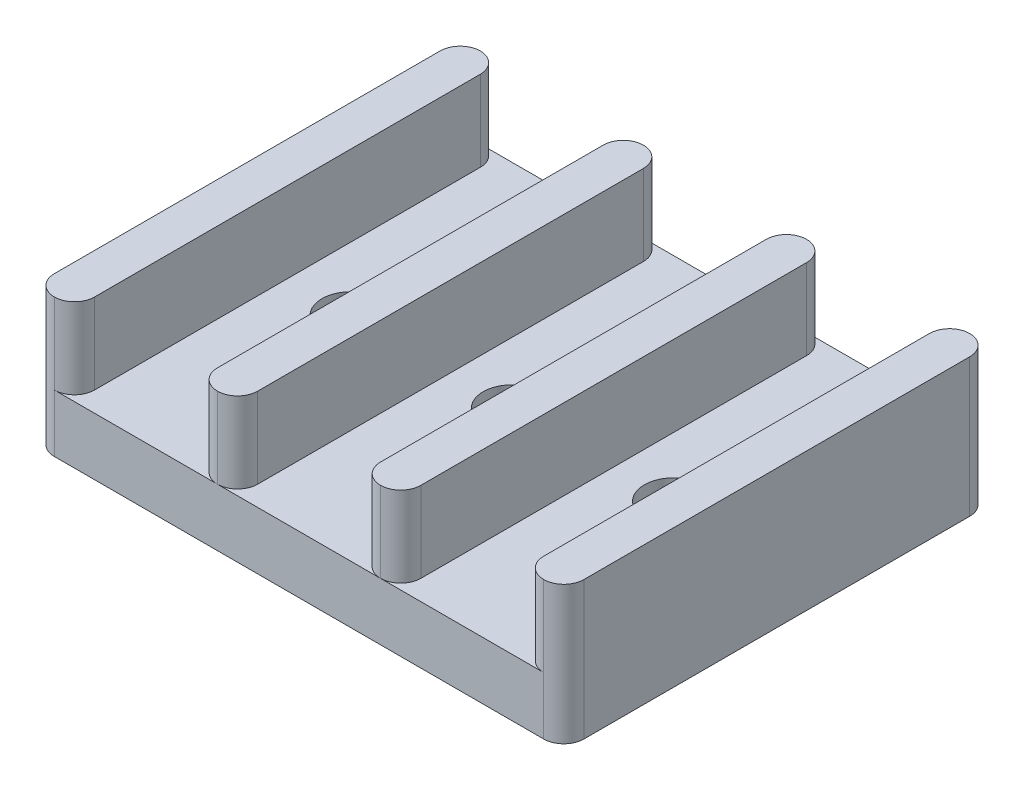
from build123d import *

# Parameters (mm, degrees)
SKETCH1_W           = 46
SKETCH1_H           = 37
SKETCH1_R           = 2.5
BOSS_EXTRUDE1_DEPTH = 12
CUT_EXTRUDE1_START  = -7
SKETCH2_W           = 10.6666
SKETCH2_H           = 37
SKETCH2_R           = 2.5
CUT_EXTRUDE1_DEPTH  = 7
FILLET1_R           = 1.75


with BuildPart() as part:
    # Sketch1 → Boss-Extrude1 (new body)
    with BuildSketch(Plane(origin=(0, 0, 0), x_dir=(1, 0, 0), z_dir=(0, 1, 0))):
        with Locations((-1.399026764, 3.604622871)):
            Rectangle(SKETCH1_W, SKETCH1_H)
        with Locations(Location((-1.399026764, 3.604622871, 0), (0, 0, 270))):
            Circle(SKETCH1_R, mode=Mode.SUBTRACT)
        with Locations(Location((-15.399026764, 3.604622871, 0), (0, 0, 270))):
            Circle(SKETCH1_R, mode=Mode.SUBTRACT)
        with Locations(Location((12.600973236, 3.604622871, 0), (0, 0, 270))):
            Circle(SKETCH1_R, mode=Mode.SUBTRACT)
    extrude(amount=BOSS_EXTRUDE1_DEPTH)

    # Sketch2 → Cut-Extrude1 (cut)
    # profile 1 of 3: a face of its own
    with BuildSketch(Plane(origin=(0, 12, 0), x_dir=(1, 0, 0), z_dir=(0, 1, 0)).offset(CUT_EXTRUDE1_START)):
        with Locations((-15.565726764, 3.604622871)):
            Rectangle(SKETCH2_W, SKETCH2_H)
        with Locations(Location((-15.399026764, 3.604622871, 0), (0, 0, 270))):
            Circle(SKETCH2_R, mode=Mode.SUBTRACT)
    # profile 2 of 3: a face of its own
    with BuildSketch(Plane(origin=(0, 12, 0), x_dir=(1, 0, 0), z_dir=(0, 1, 0)).offset(CUT_EXTRUDE1_START)):
        with Locations((-1.399126764, 3.604622871)):
            Rectangle(SKETCH2_W, SKETCH2_H)
        with Locations(Location((-1.399026764, 3.604622871, 0), (0, 0, 270))):
            Circle(SKETCH2_R, mode=Mode.SUBTRACT)
    # profile 3 of 3: a face of its own
    with BuildSketch(Plane(origin=(0, 12, 0), x_dir=(1, 0, 0), z_dir=(0, 1, 0)).offset(CUT_EXTRUDE1_START)):
        with Locations((12.767473236, 3.604622871)):
            Rectangle(SKETCH2_W, SKETCH2_H)
        with Locations(Location((12.600973236, 3.604622871, 0), (0, 0, 270))):
            Circle(SKETCH2_R, mode=Mode.SUBTRACT)
    extrude(amount=CUT_EXTRUDE1_DEPTH, mode=Mode.SUBTRACT)

    # Fillet1
    fillet1_edges = [part.edges().sort_by_distance(p)[0] for p in [
        (-10.232426764, 8.5, -22.104622871),
        (-10.232426764, 8.5, 14.895377129),
        (-20.899026764, 8.5, 14.895377129),
        (-20.899026764, 8.5, -22.104622871),
        (3.934173236, 8.5, -22.104622871),
        (3.934173236, 8.5, 14.895377129),
        (-6.732426764, 8.5, 14.895377129),
        (-6.732426764, 8.5, -22.104622871),
        (18.100773236, 8.5, -22.104622871),
        (18.100773236, 8.5, 14.895377129),
        (7.434173236, 8.5, 14.895377129),
        (7.434173236, 8.5, -22.104622871),
        (21.600973236, 6, 14.895377129),
        (-24.399026764, 6, 14.895377129),
        (-24.399026764, 6, -22.104622871),
        (21.600973236, 6, -22.104622871),
    ]]
    fillet(fillet1_edges, radius=FILLET1_R - 0.0001)  # a hair under: the kernel refuses the full size


solid = part.part
